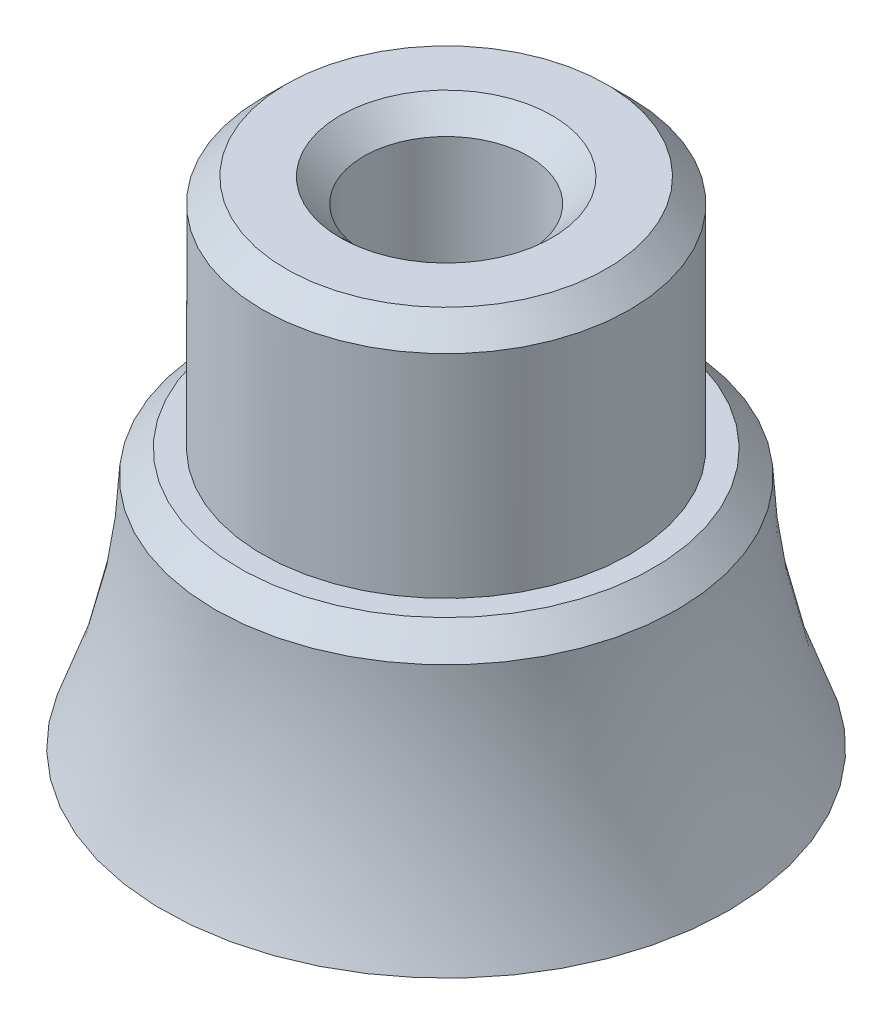
from build123d import *

# Parameters (mm, degrees)
CHAMFER1_SIZE = 0.5


with BuildPart() as part:
    # Sketch1 → Revolve1 (revolve)
    with BuildSketch(Plane.XY):
        with BuildLine():
            Line((1.75, 0), (1.75, 10.5))
            Line((1.75, 10.5), (3.9, 10.5))
            Line((3.9, 10.5), (3.9, 5.5))
            Line((3.9, 5.5), (4.9, 5.5))
            ThreePointArc((4.9, 5.5), (5.177696338, 2.695539268), (6, 0))
            Line((6, 0), (1.75, 0))
        make_face()
    revolve(axis=Axis((0, -1052.626814563, 0), (0, 1, 0)))

    # Chamfer1
    # the kernel refuses this chamfer: 0.5 mm, written as the material it takes off along each edge
    with BuildSketch(Plane(origin=(0, 0, 0), x_dir=(1, 0, 0), z_dir=(0, 0, 1))) as chamfer1_piece_1:
        Polygon((1.75 + CHAMFER1_SIZE, 0), (1.75, CHAMFER1_SIZE), (1.75, 0), align=None)
    revolve(axis=Axis((0, 0, 0), (0, 1, 0)), mode=Mode.SUBTRACT)
    with BuildSketch(Plane(origin=(0, 10.5, 0), x_dir=(1, 0, 0), z_dir=(0, 0, 1))) as chamfer1_piece_2:
        Polygon((1.75, -CHAMFER1_SIZE), (1.75 + CHAMFER1_SIZE, 0), (1.75, 0), align=None)
    revolve(axis=Axis((0, 10.5, 0), (0, 1, 0)), mode=Mode.SUBTRACT)
    with BuildSketch(Plane(origin=(0, 10.5, 0), x_dir=(1, 0, 0), z_dir=(0, 0, 1))) as chamfer1_piece_3:
        Polygon((3.9 - CHAMFER1_SIZE, 0), (3.9, -CHAMFER1_SIZE), (3.9, 0), align=None)
    revolve(axis=Axis((0, 10.5, 0), (0, 1, 0)), mode=Mode.SUBTRACT)
    with BuildSketch(Plane(origin=(0, 5.5, 0), x_dir=(1, 0, 0), z_dir=(0, 0, 1))) as chamfer1_piece_4:
        with BuildLine():
            Line((4.9 - CHAMFER1_SIZE, 0), (4.909063924, -0.509063924))
            ThreePointArc((4.909063924, -0.509063924), (4.902396158, -0.261771596), (4.9, 0))
            Line((4.9, 0), (4.9 - CHAMFER1_SIZE, 0))
        make_face()
    revolve(axis=Axis((0, 5.5, 0), (0, 1, 0)), mode=Mode.SUBTRACT)


solid = part.part
